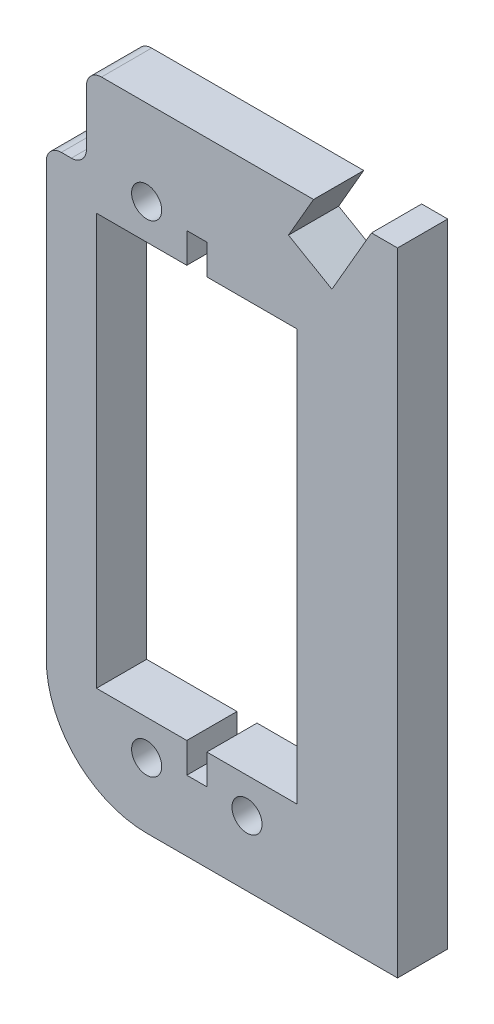
from build123d import *

# Parameters (mm, degrees)
ESQUISSE1_R        = 1.5
BOSS_EXTRU_1_DEPTH = 5
CONG_2_R           = 10
CONG_3_R           = 1.5


with BuildPart() as part:
    # Esquisse1 → Boss.-Extru.1 (new body)
    with BuildSketch(Plane.XY):
        Polygon((0, 0), (25, 0), (35, 0), (35, 63), (32.405486101, 63), (28.462110428, 56.169872981), (24.131983409, 58.669872981), (26.631983409, 63), (15, 63), (4, 63), (4, 54.5), (0, 54.5), align=None)
        with Locations((10, 54.5)):
            Circle(ESQUISSE1_R, mode=Mode.SUBTRACT)
        with Locations((20, 6.5)):
            Circle(ESQUISSE1_R, mode=Mode.SUBTRACT)
        with Locations((10, 6.5)):
            Circle(ESQUISSE1_R, mode=Mode.SUBTRACT)
        Polygon((14, 51), (5, 51), (5, 10), (14, 10), (14, 7), (16, 7), (16, 10), (25, 10), (25, 51), (16, 51), (16, 54), (14, 54), align=None, mode=Mode.SUBTRACT)
    extrude(amount=BOSS_EXTRU_1_DEPTH)

    # Congé2
    cong_2_edges = [part.edges().sort_by_distance(p)[0] for p in [
        (0, 0, 2.5),
    ]]
    fillet(cong_2_edges, radius=CONG_2_R)

    # Congé3
    cong_3_edges = [part.edges().sort_by_distance(p)[0] for p in [
        (4, 63, 2.5),
        (4, 54.5, 2.5),
        (0, 54.5, 2.5),
    ]]
    fillet(cong_3_edges, radius=CONG_3_R)


solid = part.part
